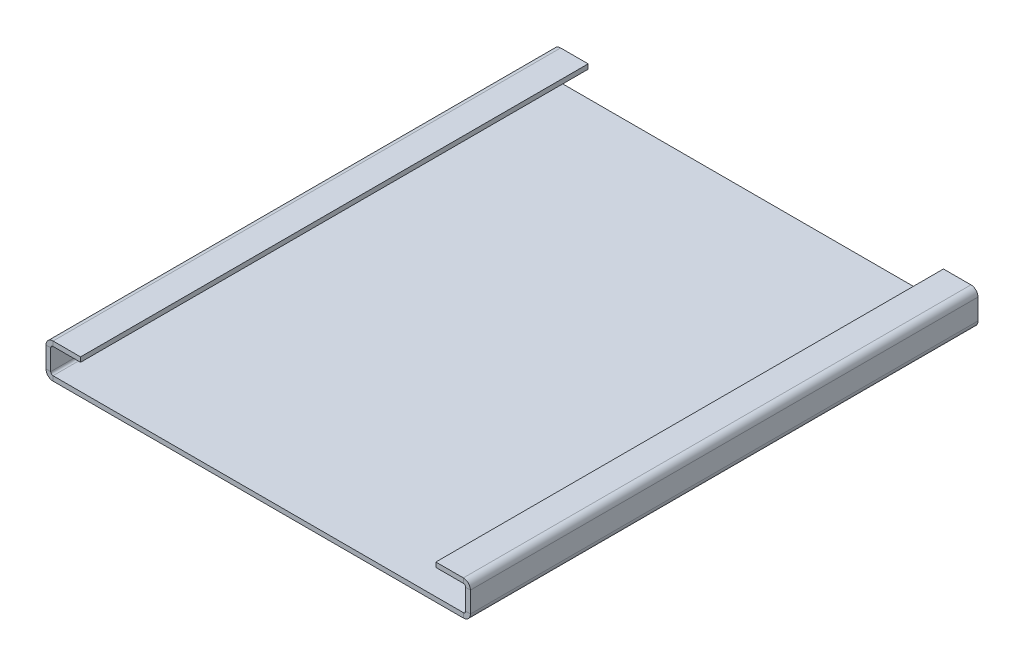
from build123d import *

# Parameters (mm, degrees)
EXTRUDE_THIN3_DEPTH    = 21.59
CONVERT_SOLID1_START   = -21.59
CONVERT_SOLID1_DEPTH   = 43.18
CONVERT_SOLID1_2_DEPTH = 43.18


# Read off the part's stored shape, not the designer's step: Convert-Solid1
with BuildPart() as part:
    # Sketch6 → Extrude-Thin3 (new, symmetric)
    with BuildSketch(Plane.XY):
        Polygon((15.113, 2.159), (17.653, 2.159), (17.653, 0), (-17.653, 0), (-17.653, 2.159), (-15.113, 2.159), (-15.113, 2.559), (-18.053, 2.559), (-18.053, -0.4), (18.053, -0.4), (18.053, 2.559), (15.113, 2.559), align=None)
    extrude(amount=EXTRUDE_THIN3_DEPTH, both=True)

    # Convert-Solid1 outline → Convert-Solid1 (cut)
    with BuildSketch(Plane.XY.offset(CONVERT_SOLID1_START)):
        with BuildLine():
            Line((-18.053, 2.559), (-18.053, 1.959))
            ThreePointArc((-18.053, 1.959), (-17.877264, 2.383264), (-17.453, 2.559))
            Line((-17.453, 2.559), (-18.053, 2.559))
        make_face()
        with BuildLine():
            Line((-18.053, -0.4), (-17.453, -0.4))
            ThreePointArc((-17.453, -0.4), (-17.877264, -0.224264), (-18.053, 0.2))
            Line((-18.053, 0.2), (-18.053, -0.4))
        make_face()
        with BuildLine():
            Line((18.053, -0.4), (18.053, 0.2))
            ThreePointArc((18.053, 0.2), (17.877264, -0.224264), (17.453, -0.4))
            Line((17.453, -0.4), (18.053, -0.4))
        make_face()
        with BuildLine():
            ThreePointArc((17.453, 2.559), (17.877264, 2.383264), (18.053, 1.959))
            Line((18.053, 1.959), (18.053, 2.559))
            Line((18.053, 2.559), (17.453, 2.559))
        make_face()
    extrude(amount=CONVERT_SOLID1_DEPTH, mode=Mode.SUBTRACT)

    # Convert-Solid1 2 outline → Convert-Solid1 2 (add)
    with BuildSketch(Plane.XY.offset(CONVERT_SOLID1_START)):
        with BuildLine():
            Line((-17.653, 2.159), (-17.653, 1.959))
            ThreePointArc((-17.653, 1.959), (-17.594421, 2.100421), (-17.453, 2.159))
            Line((-17.453, 2.159), (-17.653, 2.159))
        make_face()
        with BuildLine():
            Line((-17.653, 0), (-17.453, 0))
            ThreePointArc((-17.453, 0), (-17.594421, 0.058579), (-17.653, 0.2))
            Line((-17.653, 0.2), (-17.653, 0))
        make_face()
        with BuildLine():
            Line((17.653, 0), (17.653, 0.2))
            ThreePointArc((17.653, 0.2), (17.594421, 0.058579), (17.453, 0))
            Line((17.453, 0), (17.653, 0))
        make_face()
        with BuildLine():
            ThreePointArc((17.453, 2.159), (17.594421, 2.100421), (17.653, 1.959))
            Line((17.653, 1.959), (17.653, 2.159))
            Line((17.653, 2.159), (17.453, 2.159))
        make_face()
    extrude(amount=CONVERT_SOLID1_2_DEPTH)


solid = part.part
